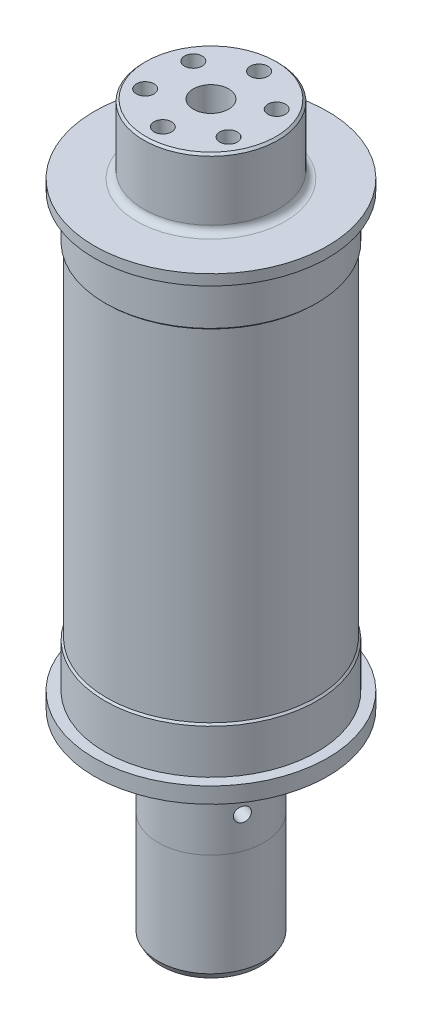
from build123d import *
from OCP.BRepFilletAPI import BRepFilletAPI_MakeChamfer

# Parameters (mm, degrees)
M6_TAPPED_HOLE1_AT_2_COUNT                   = 2
M6_TAPPED_HOLE1_AT_2_PITCH                   = 13.621602494
M6_TAPPED_HOLE1_AT_3_COUNT                   = 2
M6_TAPPED_HOLE1_AT_3_PITCH                   = 23.593307599
M6_TAPPED_HOLE1_AT_4_COUNT                   = 2
M6_TAPPED_HOLE1_AT_4_PITCH                   = 27.243204987
M6_TAPPED_HOLE1_AT_5_COUNT                   = 2
M6_TAPPED_HOLE1_AT_5_PITCH                   = 23.593307599
M6_TAPPED_HOLE1_AT_6_COUNT                   = 2
M6_TAPPED_HOLE1_AT_6_PITCH                   = 13.621602494
CBORE_FOR_M4_HEX_SOCKET_HEAD_CAP_SCR_2_COUNT = 2
CBORE_FOR_M4_HEX_SOCKET_HEAD_CAP_SCR_2_PITCH = 19.899538483
CBORE_FOR_M4_HEX_SOCKET_HEAD_CAP_SCR_3_COUNT = 2
CBORE_FOR_M4_HEX_SOCKET_HEAD_CAP_SCR_3_PITCH = 36.769552622
CBORE_FOR_M4_HEX_SOCKET_HEAD_CAP_SCR_4_COUNT = 2
CBORE_FOR_M4_HEX_SOCKET_HEAD_CAP_SCR_4_PITCH = 48.041735691
CBORE_FOR_M4_HEX_SOCKET_HEAD_CAP_SCR_5_COUNT = 2
CBORE_FOR_M4_HEX_SOCKET_HEAD_CAP_SCR_5_PITCH = 52
CBORE_FOR_M4_HEX_SOCKET_HEAD_CAP_SCR_6_COUNT = 2
CBORE_FOR_M4_HEX_SOCKET_HEAD_CAP_SCR_6_PITCH = 48.041735691
CBORE_FOR_M4_HEX_SOCKET_HEAD_CAP_SCR_7_COUNT = 2
CBORE_FOR_M4_HEX_SOCKET_HEAD_CAP_SCR_7_PITCH = 36.769552622
CBORE_FOR_M4_HEX_SOCKET_HEAD_CAP_SCR_8_COUNT = 2
CBORE_FOR_M4_HEX_SOCKET_HEAD_CAP_SCR_8_PITCH = 19.899538483
M4_TAPPED_HOLE1_AT_2_COUNT                   = 2
M4_TAPPED_HOLE1_AT_2_PITCH                   = 19.899538483
M4_TAPPED_HOLE1_AT_3_COUNT                   = 2
M4_TAPPED_HOLE1_AT_3_PITCH                   = 36.769552622
M4_TAPPED_HOLE1_AT_4_COUNT                   = 2
M4_TAPPED_HOLE1_AT_4_PITCH                   = 48.041735691
M4_TAPPED_HOLE1_AT_5_COUNT                   = 2
M4_TAPPED_HOLE1_AT_5_PITCH                   = 52
M4_TAPPED_HOLE1_AT_6_COUNT                   = 2
M4_TAPPED_HOLE1_AT_6_PITCH                   = 48.041735691
M4_TAPPED_HOLE1_AT_7_COUNT                   = 2
M4_TAPPED_HOLE1_AT_7_PITCH                   = 36.769552622
M4_TAPPED_HOLE1_AT_8_COUNT                   = 2
M4_TAPPED_HOLE1_AT_8_PITCH                   = 19.899538483
M3_TAPPED_HOLE1_AT_2_COUNT                   = 2
M3_TAPPED_HOLE1_AT_2_PITCH                   = 33.341978046
M3_TAPPED_HOLE1_AT_3_COUNT                   = 2
M3_TAPPED_HOLE1_AT_3_PITCH                   = 33.341978046
SKETCH23_W                                   = 8.5
SKETCH23_H                                   = 4
FILLET3_R                                    = 2
CHAMFER3_SIZE                                = 0.5
MOVE_FACE1_BY                                = 0.5
FILLET2_R                                    = 0.4
CHAMFER2_SIZE                                = 0.6
CHAMFER4_SIZE                                = 0.6
FILLET4_R                                    = 0.4
CHAMFER5_SIZE                                = 1
CHAMFER5_SIZE2                               = 1.732050808


# Read off the part's stored shape, not the designer's step: AdvancedHole3
with BuildPart() as part:
    # Sketch1 → Revolve1 (revolve)
    with BuildSketch(Plane.XY, mode=Mode.PRIVATE) as revolve1_sk:
        Polygon((27.5, 134.5), (27.5, 138.5), (19, 138.5), (19, 154), (0, 154), (0, 134), (0, -51.5), (15, -51.5), (15, 3.5), (22, 3.5), (22, 8), (30, 8), (30, 9), (30, 22), (29.5, 22), (29.5, 118.5), (30, 118.5), (30, 131.5), (33, 131.5), (33, 134.5), align=None)
    revolve(revolve1_sk.sketch.rotate(Axis((0, 154, 0), (0, -1, 0)), 90), axis=Axis((0, 154, 0), (0, -1, 0)))

    # Sketch5 → M6 Tapped Hole1 (revolve, cut)
    with BuildSketch(Plane(origin=(0, 154, -13.621602494), x_dir=(0, 0, 1), z_dir=(1, 0, 0))):
        Polygon((0, 0), (0, 16.502151548), (2.5, 15), (2.5, 0), align=None)
    m6_tapped_hole1 = revolve(axis=Axis((0, 160.35, -13.621602494), (0, -1, 0)), mode=Mode.SUBTRACT)

    # M6 Tapped Hole1 at 2: M6 Tapped Hole1 ×2
    with Locations(*[Vector(0.8660254037844275, 0, 0.5000000000000195) * (i * M6_TAPPED_HOLE1_AT_2_PITCH) for i in range(1, M6_TAPPED_HOLE1_AT_2_COUNT)]):
        add(m6_tapped_hole1, mode=Mode.SUBTRACT)

    # M6 Tapped Hole1 at 3: M6 Tapped Hole1 ×2
    with Locations(*[Vector(0.4999999999999613, 0, 0.866025403784461) * (i * M6_TAPPED_HOLE1_AT_3_PITCH) for i in range(1, M6_TAPPED_HOLE1_AT_3_COUNT)]):
        add(m6_tapped_hole1, mode=Mode.SUBTRACT)

    # M6 Tapped Hole1 at 4: M6 Tapped Hole1 ×2
    with Locations(*[(0, 0, i * M6_TAPPED_HOLE1_AT_4_PITCH) for i in range(1, M6_TAPPED_HOLE1_AT_4_COUNT)]):
        add(m6_tapped_hole1, mode=Mode.SUBTRACT)

    # M6 Tapped Hole1 at 5: M6 Tapped Hole1 ×2
    with Locations(*[Vector(-0.5000000000000775, 0, 0.866025403784394) * (i * M6_TAPPED_HOLE1_AT_5_PITCH) for i in range(1, M6_TAPPED_HOLE1_AT_5_COUNT)]):
        add(m6_tapped_hole1, mode=Mode.SUBTRACT)

    # M6 Tapped Hole1 at 6: M6 Tapped Hole1 ×2
    with Locations(*[Vector(-0.8660254037844947, 0, 0.4999999999999031) * (i * M6_TAPPED_HOLE1_AT_6_PITCH) for i in range(1, M6_TAPPED_HOLE1_AT_6_COUNT)]):
        add(m6_tapped_hole1, mode=Mode.SUBTRACT)

    # Sketch12 → M4 Tapped Hole1 (revolve, cut)
    with BuildSketch(Plane(origin=(-26, 8, 0), x_dir=(0, 0, -1), z_dir=(1, 0, 0))):
        Polygon((0, 0), (0, 10.991420021), (1.65, 10), (1.65, 0), align=None)
    m4_tapped_hole1 = revolve(axis=Axis((-26, 1.65, 0), (0, 1, 0)), mode=Mode.SUBTRACT)

    # M4 Tapped Hole1 at 2: M4 Tapped Hole1 ×2
    with Locations(*[Vector(0.3826834323651611, 0, 0.9238795325112572) * (i * M4_TAPPED_HOLE1_AT_2_PITCH) for i in range(1, M4_TAPPED_HOLE1_AT_2_COUNT)]):
        add(m4_tapped_hole1, mode=Mode.SUBTRACT)

    # M4 Tapped Hole1 at 3: M4 Tapped Hole1 ×2
    with Locations(*[Vector(0.7071067811866131, 0, 0.707106781186482) * (i * M4_TAPPED_HOLE1_AT_3_PITCH) for i in range(1, M4_TAPPED_HOLE1_AT_3_COUNT)]):
        add(m4_tapped_hole1, mode=Mode.SUBTRACT)

    # M4 Tapped Hole1 at 4: M4 Tapped Hole1 ×2
    with Locations(*[Vector(0.9238795325113281, 0, 0.38268343236498986) * (i * M4_TAPPED_HOLE1_AT_4_PITCH) for i in range(1, M4_TAPPED_HOLE1_AT_4_COUNT)]):
        add(m4_tapped_hole1, mode=Mode.SUBTRACT)

    # M4 Tapped Hole1 at 5: M4 Tapped Hole1 ×2
    with Locations(*[(i * M4_TAPPED_HOLE1_AT_5_PITCH, 0, 0) for i in range(1, M4_TAPPED_HOLE1_AT_5_COUNT)]):
        add(m4_tapped_hole1, mode=Mode.SUBTRACT)

    # M4 Tapped Hole1 at 6: M4 Tapped Hole1 ×2
    with Locations(*[Vector(0.9238795325112336, 0, -0.3826834323652182) * (i * M4_TAPPED_HOLE1_AT_6_PITCH) for i in range(1, M4_TAPPED_HOLE1_AT_6_COUNT)]):
        add(m4_tapped_hole1, mode=Mode.SUBTRACT)

    # M4 Tapped Hole1 at 7: M4 Tapped Hole1 ×2
    with Locations(*[Vector(0.7071067811865257, 0, -0.7071067811865693) * (i * M4_TAPPED_HOLE1_AT_7_PITCH) for i in range(1, M4_TAPPED_HOLE1_AT_7_COUNT)]):
        add(m4_tapped_hole1, mode=Mode.SUBTRACT)

    # M4 Tapped Hole1 at 8: M4 Tapped Hole1 ×2
    with Locations(*[Vector(0.38268343236504704, 0, -0.9238795325113045) * (i * M4_TAPPED_HOLE1_AT_8_PITCH) for i in range(1, M4_TAPPED_HOLE1_AT_8_COUNT)]):
        add(m4_tapped_hole1, mode=Mode.SUBTRACT)

    # Sketch21 → M3 Tapped Hole1 (revolve, cut)
    with BuildSketch(Plane(origin=(-4.982266618, 3.5, -18.594072156), x_dir=(0, 0, -1), z_dir=(1, 0, 0))):
        Polygon((0, 0), (0, 8.251075774), (1.25, 7.5), (1.25, 0), align=None)
    m3_tapped_hole1 = revolve(axis=Axis((-4.982266618, -2.85, -18.594072156), (0, 1, 0)), mode=Mode.SUBTRACT)

    # M3 Tapped Hole1 at 2: M3 Tapped Hole1 ×2
    with Locations(*[Vector(0.7071067811865451, 0, 0.70710678118655) * (i * M3_TAPPED_HOLE1_AT_2_PITCH) for i in range(1, M3_TAPPED_HOLE1_AT_2_COUNT)]):
        add(m3_tapped_hole1, mode=Mode.SUBTRACT)

    # M3 Tapped Hole1 at 3: M3 Tapped Hole1 ×2
    with Locations(*[Vector(-0.25881904510252557, 0, 0.965925826289067) * (i * M3_TAPPED_HOLE1_AT_3_PITCH) for i in range(1, M3_TAPPED_HOLE1_AT_3_COUNT)]):
        add(m3_tapped_hole1, mode=Mode.SUBTRACT)

    # Sketch23 → Cut-Revolve1 (revolve, cut)
    with BuildSketch(Plane.XY, mode=Mode.PRIVATE) as cut_revolve1_sk:
        with Locations((23.25, 136.5)):
            Rectangle(SKETCH23_W, SKETCH23_H)
    revolve(cut_revolve1_sk.sketch.rotate(Axis((0, 182.378600127, 0), (0, -1, 0)), 90), axis=Axis((0, 182.378600127, 0), (0, -1, 0)), mode=Mode.SUBTRACT)

    # Sketch29 → Ø10.0mm Dowel Hole1 (revolve, cut)
    with BuildSketch(Plane(origin=(0, 154, 0), x_dir=(0, 0, 1), z_dir=(1, 0, 0))):
        Polygon((0, 0), (0, 23.004303095), (5, 20), (5, 0), align=None)
    revolve(axis=Axis((0, 160.35, 0), (0, -1, 0)), mode=Mode.SUBTRACT)

    # AdvancedHole3 outline → AdvancedHole3 (revolve, cut)
    with BuildSketch(Plane.XZ.offset(11.7)):
        Polygon((2, -15.000019266), (2, -9), (1.025, -9), (1.025, -2), (0, -1.384117865), (0, -15.000019266), align=None)
    revolve(axis=Axis((0, -11.7, 0), (0, 0, 1)), mode=Mode.SUBTRACT)

    # AdvancedHole3 2 outline → AdvancedHole3 2 (revolve, cut)
    with BuildSketch(Plane(origin=(0, -11.7, 0), x_dir=(0, 1, 0), z_dir=(0.34202014332567204, 0, -0.9396926207859072))):
        Polygon((1.025, 9), (2, 9), (2, 15.000019266), (0, 15.000019266), (0, 1.384117865), (1.025, 2), align=None)
    revolve(axis=Axis((0, -11.7, 0), (0.9396926207859072, 0, 0.34202014332567204)), mode=Mode.SUBTRACT)

    # AdvancedHole3 3 outline → AdvancedHole3 3 (revolve, cut)
    with BuildSketch(Plane(origin=(0, -11.7, 0), x_dir=(0.7660444431189728, 0, 0.6427876096865457), z_dir=(0, 1, 0))):
        Polygon((2, -15.000019266), (2, -9), (1.025, -9), (1.025, -2), (0, -1.384117865), (0, -15.000019266), align=None)
    revolve(axis=Axis((0, -11.7, 0), (0.6427876096865457, 0, -0.7660444431189728)), mode=Mode.SUBTRACT)

    # Fillet3
    fillet3_edges = [part.edges().sort_by_distance(p)[0] for p in [
        (0, 134.5, -19),
        (0, 3.5, -15),
    ]]
    fillet(fillet3_edges, radius=FILLET3_R)

    # Chamfer3
    chamfer3_edges = [part.edges().sort_by_distance(p)[0] for p in [
        (0, 22, -30),
        (0, 118.5, -30),
    ]]
    chamfer(chamfer3_edges, length=CHAMFER3_SIZE - 0.0001)  # a hair under: the kernel refuses the full size

    # Chamfer4
    chamfer4_edges = [part.edges().sort_by_distance(p)[0] for p in [
        (0, 154, -19),
        (0, 8, -30),
    ]]
    chamfer(chamfer4_edges, length=CHAMFER4_SIZE)

    # Fillet4
    fillet4_edges = [part.edges().sort_by_distance(p)[0] for p in [
        (0, 131.5, -30),
        (0, 8, -22),
    ]]
    fillet(fillet4_edges, radius=FILLET4_R)

    # Chamfer5: one chamfer whose edges measure the first distance from different faces: ONE call of the kernel's chamfer builder (chamfer() names one face for all edges)
    chamfer5_edges_1 = [part.edges().sort_by_distance(p)[0] for p in [
        (0, -51.5, -15),
    ]]
    chamfer5_side_1 = [part.faces().sort_by_distance(p)[0] for p in [
        (0, -51.5, 0),
    ]]
    chamfer5_edges_2 = [part.edges().sort_by_distance(p)[0] for p in [
        (0, 3.5, -22),
    ]]
    chamfer5_side_2 = [part.faces().sort_by_distance(p)[0] for p in [
        (0, 3.5, -17.622253967),
    ]]
    chamfer5 = BRepFilletAPI_MakeChamfer(part.part.solid().wrapped)
    for e in chamfer5_edges_1:
        chamfer5.Add(CHAMFER5_SIZE, CHAMFER5_SIZE2, e.wrapped, chamfer5_side_1[0].wrapped)  # the first distance lies on this face
    for e in chamfer5_edges_2:
        chamfer5.Add(CHAMFER5_SIZE, CHAMFER5_SIZE2, e.wrapped, chamfer5_side_2[0].wrapped)  # the first distance lies on this face
    add(Compound.cast(chamfer5.Shape()), mode=Mode.REPLACE)


with BuildPart() as body_2:
    # Sketch3 → Revolve2 (revolve)
    with BuildSketch(Plane.XY, mode=Mode.PRIVATE) as revolve2_sk:
        Polygon((22, 8), (22, 4.5), (33, 4.5), (33, 9), (30, 9), (30, 8), align=None)
    revolve(revolve2_sk.sketch.rotate(Axis((0, 182.378600127, 0), (0, -1, 0)), 90), axis=Axis((0, 182.378600127, 0), (0, -1, 0)))

    # Sketch9 → CBORE for M4 Hex Socket Head Cap Screw1 (revolve, cut)
    with BuildSketch(Plane(origin=(18.384776311, 4.5, -18.384776311), x_dir=(0, 0, -1), z_dir=(1, 0, 0))):
        Polygon((0, 0), (0, 3.5), (2.25, 3.5), (2.25, 1.5), (3.75, 1.5), (3.75, 0), align=None)
    cbore_for_m4_hex_socket_head_cap_screw1 = revolve(axis=Axis((18.384776311, -1.85, -18.384776311), (0, 1, 0)), mode=Mode.SUBTRACT)

    # CBORE for M4 Hex Socket Head Cap Scr 2: CBORE for M4 Hex Socket Head Cap Screw1 ×2
    with Locations(*[Vector(-0.9238795325113281, 0, -0.3826834323649901) * (i * CBORE_FOR_M4_HEX_SOCKET_HEAD_CAP_SCR_2_PITCH) for i in range(1, CBORE_FOR_M4_HEX_SOCKET_HEAD_CAP_SCR_2_COUNT)]):
        add(cbore_for_m4_hex_socket_head_cap_screw1, mode=Mode.SUBTRACT)

    # CBORE for M4 Hex Socket Head Cap Scr 3: CBORE for M4 Hex Socket Head Cap Screw1 ×2
    with Locations(*[(-i * CBORE_FOR_M4_HEX_SOCKET_HEAD_CAP_SCR_3_PITCH, 0, 0) for i in range(1, CBORE_FOR_M4_HEX_SOCKET_HEAD_CAP_SCR_3_COUNT)]):
        add(cbore_for_m4_hex_socket_head_cap_screw1, mode=Mode.SUBTRACT)

    # CBORE for M4 Hex Socket Head Cap Scr 4: CBORE for M4 Hex Socket Head Cap Screw1 ×2
    with Locations(*[Vector(-0.9238795325112336, 0, 0.3826834323652182) * (i * CBORE_FOR_M4_HEX_SOCKET_HEAD_CAP_SCR_4_PITCH) for i in range(1, CBORE_FOR_M4_HEX_SOCKET_HEAD_CAP_SCR_4_COUNT)]):
        add(cbore_for_m4_hex_socket_head_cap_screw1, mode=Mode.SUBTRACT)

    # CBORE for M4 Hex Socket Head Cap Scr 5: CBORE for M4 Hex Socket Head Cap Screw1 ×2
    with Locations(*[Vector(-0.7071067811864383, 0, 0.7071067811866567) * (i * CBORE_FOR_M4_HEX_SOCKET_HEAD_CAP_SCR_5_PITCH) for i in range(1, CBORE_FOR_M4_HEX_SOCKET_HEAD_CAP_SCR_5_COUNT)]):
        add(cbore_for_m4_hex_socket_head_cap_screw1, mode=Mode.SUBTRACT)

    # CBORE for M4 Hex Socket Head Cap Scr 6: CBORE for M4 Hex Socket Head Cap Screw1 ×2
    with Locations(*[Vector(-0.3826834323649327, 0, 0.9238795325113518) * (i * CBORE_FOR_M4_HEX_SOCKET_HEAD_CAP_SCR_6_PITCH) for i in range(1, CBORE_FOR_M4_HEX_SOCKET_HEAD_CAP_SCR_6_COUNT)]):
        add(cbore_for_m4_hex_socket_head_cap_screw1, mode=Mode.SUBTRACT)

    # CBORE for M4 Hex Socket Head Cap Scr 7: CBORE for M4 Hex Socket Head Cap Screw1 ×2
    with Locations(*[(0, 0, i * CBORE_FOR_M4_HEX_SOCKET_HEAD_CAP_SCR_7_PITCH) for i in range(1, CBORE_FOR_M4_HEX_SOCKET_HEAD_CAP_SCR_7_COUNT)]):
        add(cbore_for_m4_hex_socket_head_cap_screw1, mode=Mode.SUBTRACT)

    # CBORE for M4 Hex Socket Head Cap Scr 8: CBORE for M4 Hex Socket Head Cap Screw1 ×2
    with Locations(*[Vector(0.38268343236527536, 0, 0.9238795325112099) * (i * CBORE_FOR_M4_HEX_SOCKET_HEAD_CAP_SCR_8_PITCH) for i in range(1, CBORE_FOR_M4_HEX_SOCKET_HEAD_CAP_SCR_8_COUNT)]):
        add(cbore_for_m4_hex_socket_head_cap_screw1, mode=Mode.SUBTRACT)

    # Move Face1: a face moved inward by 0.5
    extrude(body_2.faces().sort_by_distance((24, 8, -15))[0], amount=MOVE_FACE1_BY, dir=(0, -1, 0), mode=Mode.SUBTRACT)

    # Fillet2
    fillet2_edges = [body_2.edges().sort_by_distance(p)[0] for p in [
        (0, 7.5, -30),
    ]]
    fillet(fillet2_edges, radius=FILLET2_R)

    # Chamfer2
    chamfer2_edges = [body_2.edges().sort_by_distance(p)[0] for p in [
        (0, 7.5, -22),
    ]]
    chamfer(chamfer2_edges, length=CHAMFER2_SIZE)


solid = Compound([part.part, body_2.part])
